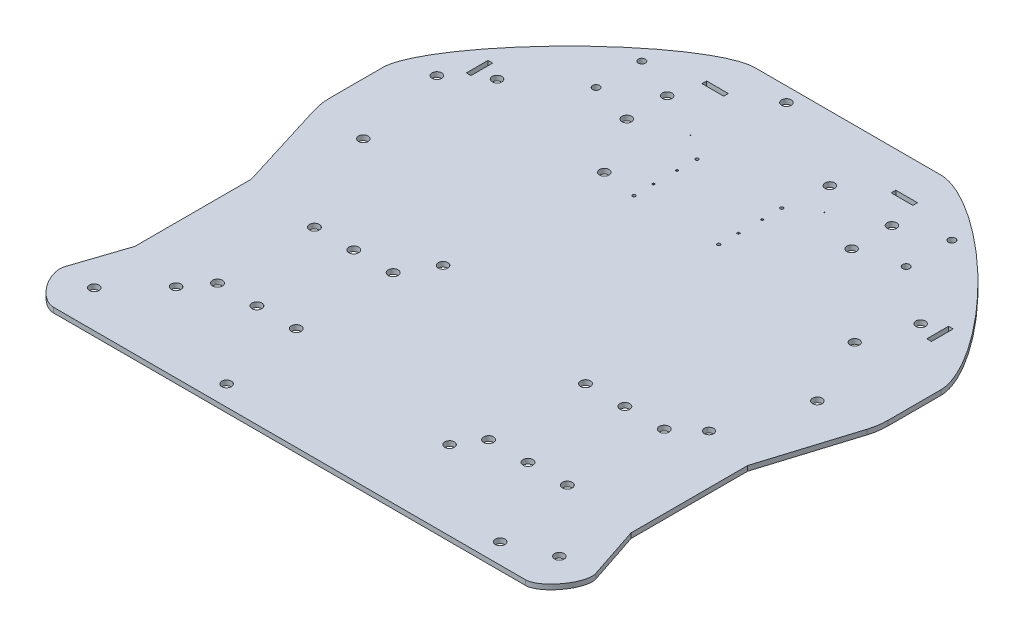
from build123d import *

# Parameters (mm, degrees)
SKETCH1_W           = 80
SKETCH1_H           = 30
SKETCH1_W_2         = 50
BOSS_EXTRUDE1_DEPTH = 1.6
FILLET1_SIZE        = 60
SKETCH6_W           = 80
SKETCH6_H           = 30
CUT_EXTRUDE1_DEPTH  = 10
FILLET3_R           = 20
SKETCH8_R           = 1.55
SKETCH8_R_2         = 1.5875
SKETCH8_R_3         = 1.5
SKETCH8_W           = 7
SKETCH8_H           = 1.5
SKETCH8_W_2         = 1.5
SKETCH8_H_2         = 7
CUT_EXTRUDE2_DEPTH  = 1.6
CUT_EXTRUDE3_REACH  = 256.563
SKETCH9_R           = 1.55
SKETCH9_R_2         = 0.5
SKETCH9_R_3         = 1.143
SKETCH9_W           = 0.24
SKETCH9_H           = 0.24
SKETCH9_W_2         = 0.635
SKETCH9_H_2         = 0.635


with BuildPart() as part:
    # Sketch1 → Boss-Extrude1 (new body)
    with BuildSketch(Plane(origin=(0, 0, 0), x_dir=(1, 0, 0), z_dir=(0, 1, 0))):
        with Locations((-90, -15)):
            Rectangle(SKETCH1_W, SKETCH1_H)
        Polygon((0, 180), (-180, 180), (-180, 30), (-130, 30), (-50, 30), (0, 30), align=None)
        with Locations((-25, 15)):
            Rectangle(SKETCH1_W_2, SKETCH1_H)
        with Locations((-155, 15)):
            Rectangle(SKETCH1_W_2, SKETCH1_H)
        with Locations((-90, 15)):
            Rectangle(SKETCH1_W, SKETCH1_H)
    extrude(amount=BOSS_EXTRUDE1_DEPTH)

    # Fillet1
    # a fillet whose section is not a circle: 60 mm, written as the material it takes off along each edge
    with BuildSketch(Plane(origin=(0, -150, -180), x_dir=(0, 0, 1), z_dir=(0, 1, 0)), Plane(origin=(-180, -150, -180), x_dir=(1, 0, 0), z_dir=(0, 1, 0))) as fillet1_piece_1:
        with BuildLine():
            Bezier((FILLET1_SIZE, 0), (0, 0), (0, -FILLET1_SIZE), weights=[1, 0.25, 1])
            Line((0, -FILLET1_SIZE), (0, 0))
            Line((0, 0), (FILLET1_SIZE, 0))
        make_face()
    extrude(amount=301.6, mode=Mode.SUBTRACT)

    # Sketch6 → Cut-Extrude1 (cut)
    with BuildSketch(Plane(origin=(0, 1.6, 0), x_dir=(1, 0, 0), z_dir=(0, 1, 0))):
        with Locations((-90, -15)):
            Rectangle(SKETCH6_W, SKETCH6_H)
        Polygon((-180, 100), (-180, 0), (-170, 30.1112758), (-170, 67.7112758), align=None)
        Polygon((-10, 30.1112758), (0, 0), (0, 100), (-10, 67.7112758), align=None)
    extrude(amount=-CUT_EXTRUDE1_DEPTH, mode=Mode.SUBTRACT)

    # Fillet2
    # a fillet whose section is not a circle: 10 mm, written as the material it takes off along each edge
    with BuildSketch(Plane(origin=(-180, -34.645129191, 0), x_dir=(1, 0, 0), z_dir=(0, 1, 0)), Plane(origin=(0, -34.645129191, 0), x_dir=(-0.31517542959468753, 0, -0.9490334285892168), z_dir=(0, 1, 0))) as fillet2_piece_1:
        with BuildLine():
            Bezier((13.858051676, 0), (0, 0), (4.36771739, 13.151754296), weights=[1, 0.333333333, 1])
            Line((4.36771739, 13.151754296), (0, 0))
            Line((0, 0), (13.858051676, 0))
        make_face()
    extrude(amount=70.890258382, mode=Mode.SUBTRACT)

    # Fillet3
    fillet3_edges = [part.edges().sort_by_distance(p)[0] for p in [
        (0, 0.8, -100),
        (-180, 0.8, -100),
    ]]
    fillet(fillet3_edges, radius=FILLET3_R)

    # Sketch8 → Cut-Extrude2 (cut)
    with BuildSketch(Plane(origin=(0, 1.6, 0), x_dir=(1, 0, 0), z_dir=(0, 1, 0))):
        with Locations(Location((-105.104964584, 175.33109831, 0), (0, 0, 270))):
            Circle(SKETCH8_R)
        with Locations(Location((-74.900170028, 159.13122779, 0), (0, 0, 270))):
            Circle(SKETCH8_R)
        with Locations(Location((-115, 74.5, 0), (0, 0, 270))):
            Circle(SKETCH8_R)
        with Locations(Location((-115, 126.5, 0), (0, 0, 270))):
            Circle(SKETCH8_R)
        with Locations(Location((-146.4125, 64.417, 0), (0, 0, 270))):
            Circle(SKETCH8_R_2)
        with Locations(Location((-133.7125, 64.417, 0), (0, 0, 270))):
            Circle(SKETCH8_R_2)
        with Locations(Location((-121.0125, 64.417, 0), (0, 0, 270))):
            Circle(SKETCH8_R_2)
        with Locations(Location((-146.4125, 33.175, 0), (0, 0, 270))):
            Circle(SKETCH8_R_2)
        with Locations(Location((-133.7125, 33.175, 0), (0, 0, 270))):
            Circle(SKETCH8_R_2)
        with Locations(Location((-121.0125, 33.175, 0), (0, 0, 270))):
            Circle(SKETCH8_R_2)
        with Locations(Location((-58.9875, 64.417, 0), (0, 0, 270))):
            Circle(SKETCH8_R_2)
        with Locations(Location((-46.2875, 64.417, 0), (0, 0, 270))):
            Circle(SKETCH8_R_2)
        with Locations(Location((-33.5875, 64.417, 0), (0, 0, 270))):
            Circle(SKETCH8_R_2)
        with Locations(Location((-33.5875, 33.175, 0), (0, 0, 270))):
            Circle(SKETCH8_R_2)
        with Locations(Location((-46.2875, 33.175, 0), (0, 0, 270))):
            Circle(SKETCH8_R_2)
        with Locations(Location((-58.9875, 33.175, 0), (0, 0, 270))):
            Circle(SKETCH8_R_2)
        with Locations(Location((-63.9, 25.5, 0), (0, 0, 270))):
            Circle(SKETCH8_R)
        with Locations(Location((-28.6, 6.5, 0), (0, 0, 270))):
            Circle(SKETCH8_R)
        with Locations(Location((-116.8, 6.5, 0), (0, 0, 270))):
            Circle(SKETCH8_R)
        with Locations(Location((-152.1, 25.5, 0), (0, 0, 270))):
            Circle(SKETCH8_R)
        with Locations(Location((-27.14, 119.392, 0), (0, 0, 270))):
            Circle(SKETCH8_R_3)
        with Locations(Location((-25.87, 71.132, 0), (0, 0, 270))):
            Circle(SKETCH8_R_3)
        with Locations(Location((-169, 126.5, 0), (0, 0, 270))):
            Circle(SKETCH8_R)
        with Locations(Location((-126.25, 145, 0), (0, 0, 270))):
            Circle(SKETCH8_R)
        with Locations(Location((-53.75, 145, 0), (0, 0, 270))):
            Circle(SKETCH8_R)
        with Locations(Location((-165, 12, 0), (0, 0, 270))):
            Circle(SKETCH8_R)
        with Locations(Location((-15, 12, 0), (0, 0, 270))):
            Circle(SKETCH8_R)
        with Locations((-59.5, 167.75)):
            Rectangle(SKETCH8_W, SKETCH8_H)
        with Locations((-120.5, 167.75)):
            Rectangle(SKETCH8_W, SKETCH8_H)
        with Locations((-164.25, 135.5)):
            Rectangle(SKETCH8_W_2, SKETCH8_H_2)
        with Locations((-15.75, 135.5)):
            Rectangle(SKETCH8_W_2, SKETCH8_H_2)
    extrude(amount=-CUT_EXTRUDE2_DEPTH, mode=Mode.SUBTRACT)

    # Sketch9 → Cut-Extrude3 (cut, up to next)
    with BuildSketch(Plane.XZ, mode=Mode.PRIVATE) as cut_extrude3_sk1:
        with Locations(Location((-163.2, -97, 0), (0, 0, 270))):
            Circle(SKETCH9_R)
    cut_extrude3_tool1 = extrude(cut_extrude3_sk1.sketch, amount=-CUT_EXTRUDE3_REACH, mode=Mode.PRIVATE) & part.part
    # Sketch9 → Cut-Extrude3 (cut, up to next)
    with BuildSketch(Plane.XZ, mode=Mode.PRIVATE) as cut_extrude3_sk2:
        with Locations(Location((-158.3, -135.2, 0), (0, 0, 270))):
            Circle(SKETCH9_R)
    cut_extrude3_tool2 = extrude(cut_extrude3_sk2.sketch, amount=-CUT_EXTRUDE3_REACH, mode=Mode.PRIVATE) & part.part
    # Sketch9 → Cut-Extrude3 (cut, up to next)
    with BuildSketch(Plane.XZ, mode=Mode.PRIVATE) as cut_extrude3_sk3:
        with Locations(Location((-126.25, -158, 0), (0, 0, 270))):
            Circle(SKETCH9_R)
    cut_extrude3_tool3 = extrude(cut_extrude3_sk3.sketch, amount=-CUT_EXTRUDE3_REACH, mode=Mode.PRIVATE) & part.part
    # Sketch9 → Cut-Extrude3 (cut, up to next)
    with BuildSketch(Plane.XZ, mode=Mode.PRIVATE) as cut_extrude3_sk4:
        with Locations(Location((-53.75, -158, 0), (0, 0, 270))):
            Circle(SKETCH9_R)
    cut_extrude3_tool4 = extrude(cut_extrude3_sk4.sketch, amount=-CUT_EXTRUDE3_REACH, mode=Mode.PRIVATE) & part.part
    # Sketch9 → Cut-Extrude3 (cut, up to next)
    with BuildSketch(Plane.XZ, mode=Mode.PRIVATE) as cut_extrude3_sk5:
        with Locations(Location((-21.7, -135.2, 0), (0, 0, 270))):
            Circle(SKETCH9_R)
    cut_extrude3_tool5 = extrude(cut_extrude3_sk5.sketch, amount=-CUT_EXTRUDE3_REACH, mode=Mode.PRIVATE) & part.part
    # Sketch9 → Cut-Extrude3 (cut, up to next)
    with BuildSketch(Plane.XZ, mode=Mode.PRIVATE) as cut_extrude3_sk6:
        with Locations(Location((-16.8, -97, 0), (0, 0, 270))):
            Circle(SKETCH9_R)
    cut_extrude3_tool6 = extrude(cut_extrude3_sk6.sketch, amount=-CUT_EXTRUDE3_REACH, mode=Mode.PRIVATE) & part.part
    # Sketch9 → Cut-Extrude3 (cut, up to next)
    with BuildSketch(Plane.XZ, mode=Mode.PRIVATE) as cut_extrude3_sk7:
        with Locations(Location((-76.405, -124.775, 0), (0, 0, 270))):
            Circle(SKETCH9_R_2)
    cut_extrude3_tool7 = extrude(cut_extrude3_sk7.sketch, amount=-CUT_EXTRUDE3_REACH, mode=Mode.PRIVATE) & part.part
    # Sketch9 → Cut-Extrude3 (cut, up to next)
    with BuildSketch(Plane.XZ, mode=Mode.PRIVATE) as cut_extrude3_sk8:
        with Locations(Location((-103.71, -145.095, 0), (0, 0, 270))):
            Circle(SKETCH9_R_2)
    cut_extrude3_tool8 = extrude(cut_extrude3_sk8.sketch, amount=-CUT_EXTRUDE3_REACH, mode=Mode.PRIVATE) & part.part
    # Sketch9 → Cut-Extrude3 (cut, up to next)
    with BuildSketch(Plane.XZ, mode=Mode.PRIVATE) as cut_extrude3_sk9:
        with Locations(Location((-76.405, -145.095, 0), (0, 0, 270))):
            Circle(SKETCH9_R_2)
    cut_extrude3_tool9 = extrude(cut_extrude3_sk9.sketch, amount=-CUT_EXTRUDE3_REACH, mode=Mode.PRIVATE) & part.part
    # Sketch9 → Cut-Extrude3 (cut, up to next)
    with BuildSketch(Plane.XZ, mode=Mode.PRIVATE) as cut_extrude3_sk10:
        with Locations(Location((-103.71, -124.775, 0), (0, 0, 270))):
            Circle(SKETCH9_R_2)
    cut_extrude3_tool10 = extrude(cut_extrude3_sk10.sketch, amount=-CUT_EXTRUDE3_REACH, mode=Mode.PRIVATE) & part.part
    # Sketch9 → Cut-Extrude3 (cut, up to next)
    with BuildSketch(Plane.XZ, mode=Mode.PRIVATE) as cut_extrude3_sk11:
        with Locations(Location((-140, -148.857, 0), (0, 0, 270))):
            Circle(SKETCH9_R_3)
    cut_extrude3_tool11 = extrude(cut_extrude3_sk11.sketch, amount=-CUT_EXTRUDE3_REACH, mode=Mode.PRIVATE) & part.part
    # Sketch9 → Cut-Extrude3 (cut, up to next)
    with BuildSketch(Plane.XZ, mode=Mode.PRIVATE) as cut_extrude3_sk12:
        with Locations(Location((-140, -163.589, 0), (0, 0, 270))):
            Circle(SKETCH9_R_3)
    cut_extrude3_tool12 = extrude(cut_extrude3_sk12.sketch, amount=-CUT_EXTRUDE3_REACH, mode=Mode.PRIVATE) & part.part
    # Sketch9 → Cut-Extrude3 (cut, up to next)
    with BuildSketch(Plane.XZ, mode=Mode.PRIVATE) as cut_extrude3_sk13:
        with Locations(Location((-40, -148.857003255, 0), (0, 0, 270))):
            Circle(SKETCH9_R_3)
    cut_extrude3_tool13 = extrude(cut_extrude3_sk13.sketch, amount=-CUT_EXTRUDE3_REACH, mode=Mode.PRIVATE) & part.part
    # Sketch9 → Cut-Extrude3 (cut, up to next)
    with BuildSketch(Plane.XZ, mode=Mode.PRIVATE) as cut_extrude3_sk14:
        with Locations(Location((-40, -163.589003255, 0), (0, 0, 270))):
            Circle(SKETCH9_R_3)
    cut_extrude3_tool14 = extrude(cut_extrude3_sk14.sketch, amount=-CUT_EXTRUDE3_REACH, mode=Mode.PRIVATE) & part.part
    # Sketch9 → Cut-Extrude3 (cut, up to next)
    with BuildSketch(Plane.XZ, mode=Mode.PRIVATE) as cut_extrude3_sk15:
        with Locations((-68.3, -150.77)):
            Rectangle(SKETCH9_W, SKETCH9_H)
    cut_extrude3_tool15 = extrude(cut_extrude3_sk15.sketch, amount=-CUT_EXTRUDE3_REACH, mode=Mode.PRIVATE) & part.part
    # Sketch9 → Cut-Extrude3 (cut, up to next)
    with BuildSketch(Plane.XZ, mode=Mode.PRIVATE) as cut_extrude3_sk16:
        with Locations((-111.48, -150.77)):
            Rectangle(SKETCH9_W, SKETCH9_H)
    cut_extrude3_tool16 = extrude(cut_extrude3_sk16.sketch, amount=-CUT_EXTRUDE3_REACH, mode=Mode.PRIVATE) & part.part
    # Sketch9 → Cut-Extrude3 (cut, up to next)
    with BuildSketch(Plane.XZ, mode=Mode.PRIVATE) as cut_extrude3_sk17:
        with Locations((-76.3275, -138.745)):
            Rectangle(SKETCH9_W_2, SKETCH9_H_2)
    cut_extrude3_tool17 = extrude(cut_extrude3_sk17.sketch, amount=-CUT_EXTRUDE3_REACH, mode=Mode.PRIVATE) & part.part
    # Sketch9 → Cut-Extrude3 (cut, up to next)
    with BuildSketch(Plane.XZ, mode=Mode.PRIVATE) as cut_extrude3_sk18:
        with Locations((-76.3275, -131.125)):
            Rectangle(SKETCH9_W_2, SKETCH9_H_2)
    cut_extrude3_tool18 = extrude(cut_extrude3_sk18.sketch, amount=-CUT_EXTRUDE3_REACH, mode=Mode.PRIVATE) & part.part
    # Sketch9 → Cut-Extrude3 (cut, up to next)
    with BuildSketch(Plane.XZ, mode=Mode.PRIVATE) as cut_extrude3_sk19:
        with Locations((-103.7875, -138.745)):
            Rectangle(SKETCH9_W_2, SKETCH9_H_2)
    cut_extrude3_tool19 = extrude(cut_extrude3_sk19.sketch, amount=-CUT_EXTRUDE3_REACH, mode=Mode.PRIVATE) & part.part
    # Sketch9 → Cut-Extrude3 (cut, up to next)
    with BuildSketch(Plane.XZ, mode=Mode.PRIVATE) as cut_extrude3_sk20:
        with Locations((-103.7875, -131.125)):
            Rectangle(SKETCH9_W_2, SKETCH9_H_2)
    cut_extrude3_tool20 = extrude(cut_extrude3_sk20.sketch, amount=-CUT_EXTRUDE3_REACH, mode=Mode.PRIVATE) & part.part
    add(cut_extrude3_tool1.solids().sort_by_distance((-163.2, 0, -97))[0], mode=Mode.SUBTRACT)
    add(cut_extrude3_tool2.solids().sort_by_distance((-158.3, 0, -135.2))[0], mode=Mode.SUBTRACT)
    add(cut_extrude3_tool3.solids().sort_by_distance((-126.25, 0, -158))[0], mode=Mode.SUBTRACT)
    add(cut_extrude3_tool4.solids().sort_by_distance((-53.75, 0, -158))[0], mode=Mode.SUBTRACT)
    add(cut_extrude3_tool5.solids().sort_by_distance((-21.7, 0, -135.2))[0], mode=Mode.SUBTRACT)
    add(cut_extrude3_tool6.solids().sort_by_distance((-16.8, 0, -97))[0], mode=Mode.SUBTRACT)
    add(cut_extrude3_tool7.solids().sort_by_distance((-76.405, 0, -124.775))[0], mode=Mode.SUBTRACT)
    add(cut_extrude3_tool8.solids().sort_by_distance((-103.71, 0, -145.095))[0], mode=Mode.SUBTRACT)
    add(cut_extrude3_tool9.solids().sort_by_distance((-76.405, 0, -145.095))[0], mode=Mode.SUBTRACT)
    add(cut_extrude3_tool10.solids().sort_by_distance((-103.71, 0, -124.775))[0], mode=Mode.SUBTRACT)
    add(cut_extrude3_tool11.solids().sort_by_distance((-140, 0, -148.857))[0], mode=Mode.SUBTRACT)
    add(cut_extrude3_tool12.solids().sort_by_distance((-140, 0, -163.589))[0], mode=Mode.SUBTRACT)
    add(cut_extrude3_tool13.solids().sort_by_distance((-40, 0, -148.857003))[0], mode=Mode.SUBTRACT)
    add(cut_extrude3_tool14.solids().sort_by_distance((-40, 0, -163.589003))[0], mode=Mode.SUBTRACT)
    add(cut_extrude3_tool15.solids().sort_by_distance((-68.3, 0, -150.77))[0], mode=Mode.SUBTRACT)
    add(cut_extrude3_tool16.solids().sort_by_distance((-111.48, 0, -150.77))[0], mode=Mode.SUBTRACT)
    add(cut_extrude3_tool17.solids().sort_by_distance((-76.3275, 0, -138.745))[0], mode=Mode.SUBTRACT)
    add(cut_extrude3_tool18.solids().sort_by_distance((-76.3275, 0, -131.125))[0], mode=Mode.SUBTRACT)
    add(cut_extrude3_tool19.solids().sort_by_distance((-103.7875, 0, -138.745))[0], mode=Mode.SUBTRACT)
    add(cut_extrude3_tool20.solids().sort_by_distance((-103.7875, 0, -131.125))[0], mode=Mode.SUBTRACT)


solid = part.part
